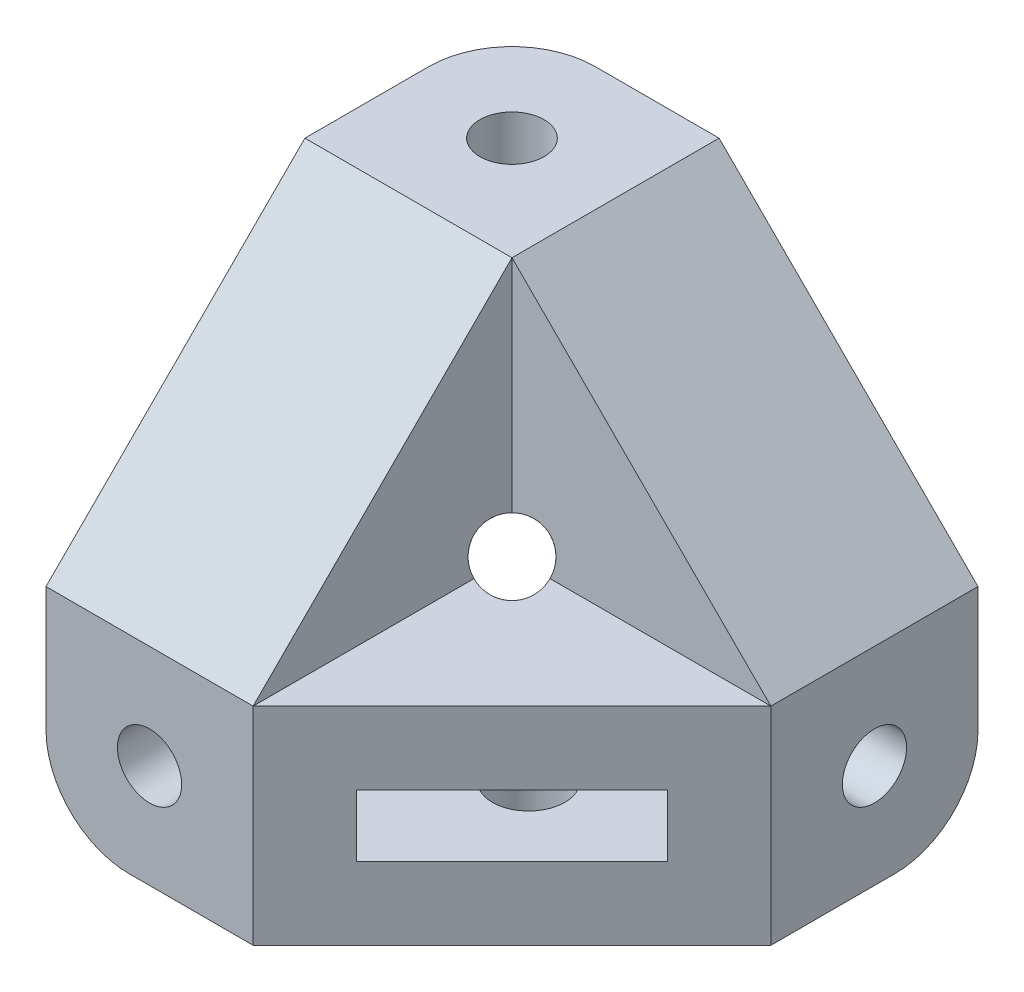
from build123d import *

# Parameters (mm, degrees)
ESBO_O1_W                        = 45
ESBO_O1_H                        = 45
RESSALTO_EXTRUS_O1_DEPTH         = 20
ESBO_O2_W                        = 25
ESBO_O2_H                        = 25
CORTE_EXTRUS_O1_DEPTH            = 70.705238631
ESBO_O3_W                        = 20
ESBO_O3_H                        = 20
RESSALTO_EXTRUS_O2_DEPTH         = 25
FURO_DE_DI_METRO_6_2_6_2_1_D     = 6.2
FURO_DE_DI_METRO_6_2_6_2_1_DEPTH = 35
FURO_DE_DI_METRO_6_2_6_2_2_D     = 6.2
FURO_DE_DI_METRO_6_2_6_2_2_DEPTH = 35
FURO_DE_DI_METRO_6_2_6_2_3_D     = 6.2
FURO_DE_DI_METRO_6_2_6_2_3_DEPTH = 35
FILETE2_R                        = 8
CHANFRO1_SIZE                    = 25
CHANFRO2_SIZE                    = 25
RESSALTO_EXTRUS_O3_DEPTH         = 20
ESBO_O12_R                       = 3
CORTE_EXTRUS_O2_DEPTH            = 71.906960985
CORTE_EXTRUS_O5_DEPTH            = 3
CORTE_EXTRUS_O5_DEPTH_BACK       = 3
ESBO_O18_R                       = 3.5
CORTE_EXTRUS_O6_DEPTH            = 69.698424668


# Some blends are built 0.0001 mm under size
with BuildPart() as part:
    # Esboço1 → Ressalto-extrusão1 (new body)
    with BuildSketch(Plane.XY.offset(20)):
        with Locations((-12.862035225, 34.142270059)):
            Rectangle(ESBO_O1_W, ESBO_O1_H)
    extrude(amount=-RESSALTO_EXTRUS_O1_DEPTH)

    # Esboço2 → Corte-extrusão1 (cut, through all)
    with BuildSketch(Plane(origin=(0, 0, 0), x_dir=(-1, 0, 0), z_dir=(0, 0, -1))):
        with Locations((2.862035225, 44.142270059)):
            Rectangle(ESBO_O2_W, ESBO_O2_H)
    extrude(amount=-CORTE_EXTRUS_O1_DEPTH, mode=Mode.SUBTRACT)

    # Esboço3 → Ressalto-extrusão2 (add)
    with BuildSketch(Plane.XY.offset(20)):
        with Locations((-25.362035225, 21.642270059)):
            Rectangle(ESBO_O3_W, ESBO_O3_H)
    extrude(amount=RESSALTO_EXTRUS_O2_DEPTH)

    # Furo de diâmetro Ø6.2 (6.2)1
    with Locations(Plane(origin=(9.637964775, 0, 0), x_dir=(0, 0, -1), z_dir=(1, 0, 0))):
        with Locations((-10, 21.642270059)):
            Hole(FURO_DE_DI_METRO_6_2_6_2_1_D / 2, depth=FURO_DE_DI_METRO_6_2_6_2_1_DEPTH)

    # Furo de diâmetro Ø6.2 (6.2)2
    with Locations(Plane(origin=(0, 56.642270059, 0), x_dir=(1, 0, 0), z_dir=(0, 1, 0))):
        with Locations((-25.362035225, -10)):
            Hole(FURO_DE_DI_METRO_6_2_6_2_2_D / 2, depth=FURO_DE_DI_METRO_6_2_6_2_2_DEPTH)

    # Furo de diâmetro Ø6.2 (6.2)3
    with Locations(Plane.XY.offset(45)):
        with Locations((-25.362035225, 21.642270059)):
            Hole(FURO_DE_DI_METRO_6_2_6_2_3_D / 2, depth=FURO_DE_DI_METRO_6_2_6_2_3_DEPTH)

    # Filete2
    filete2_edges = [part.edges().sort_by_distance(p)[0] for p in [
        (-35.362035225, 34.142270059, 0),
        (-12.862035225, 11.642270059, 0),
        (-35.362035225, 11.642270059, 22.5),
    ]]
    fillet(filete2_edges, radius=FILETE2_R)

    # Chanfro1
    # the kernel refuses this chamfer: 25 mm, written as the material it adds along each edge
    with BuildSketch(Plane(origin=(-35.362035225, 31.642270059, 20), x_dir=(0, -0.027495876610586317, 0.9996219169112966), z_dir=(1, 0, 0))) as chanfro1_piece_1_section:
        Polygon((CHANFRO1_SIZE * 0.999621916911, -CHANFRO1_SIZE * 0.0274958766106), (-CHANFRO1_SIZE * 0.0274958766106, -CHANFRO1_SIZE * 0.999621916911), (0, 0), align=None)
    chanfro1_piece_1 = extrude(amount=20, mode=Mode.PRIVATE)
    chanfro1_piece_1 = split(chanfro1_piece_1, bisect_by=Plane(origin=(-25.362035225, 39.873368248, 45), z_dir=(0, 0, -1)), keep=Keep.TOP, mode=Mode.PRIVATE)
    chanfro1_piece_1 = split(chanfro1_piece_1, bisect_by=Plane(origin=(-25.362035225, 56.642270059, 28.231098189), z_dir=(0, -1, 0)), keep=Keep.TOP, mode=Mode.PRIVATE)
    add(chanfro1_piece_1)

    # Chanfro2
    chanfro2_edges = [part.edges().sort_by_distance(p)[0] for p in [
        (-15.362035225, 31.642270059, 10),
    ]]
    chamfer(chanfro2_edges, length=CHANFRO2_SIZE - 0.0001)  # a hair under: the kernel refuses the full size

    # Esboço10 → Ressalto-extrusão3 (add)
    with BuildSketch(Plane.XZ.offset(-11.642270059)):
        Polygon((-15.362035225, 45), (9.637964775, 20), (-15.362035225, 20), align=None)
    extrude(amount=-RESSALTO_EXTRUS_O3_DEPTH)

    # Esboço12 → Corte-extrusão2 (cut, through all)
    with BuildSketch(Plane(origin=(20.426744945, 20.426744945, 20.426744945), x_dir=(-0.8164965809277259, 0.408248290463863, 0.4082482904638632), z_dir=(-0.577350269189626, -0.5773502691896256, -0.5773502691896258))):
        with Locations(Location((33.625917704, 8.232328107, 0), (0, 0, 120.000005232))):
            Circle(ESBO_O12_R)
    extrude(amount=CORTE_EXTRUS_O2_DEPTH, mode=Mode.SUBTRACT)

    # Esboço16 → Corte-extrusão5 (cut, two sides: drawn at the far end of the back side and taken through both)
    with BuildSketch(Plane(origin=(0, 21.642270059, 0), x_dir=(-1, 0, 0), z_dir=(0, -1, 0)).offset(-CORTE_EXTRUS_O5_DEPTH_BACK)):
        Polygon((10.362035225, -40), (17.262035225, -33.1), (17.262035225, -18.1), (-4.637964775, -18.1), (-4.637964775, -25), align=None)
    extrude(amount=CORTE_EXTRUS_O5_DEPTH + CORTE_EXTRUS_O5_DEPTH_BACK, mode=Mode.SUBTRACT)

    # Esboço18 → Corte-extrusão6 (cut, through all)
    with BuildSketch(Plane(origin=(0, 18.642270059, 0), x_dir=(1, 0, 0), z_dir=(0, 1, 0))):
        with Locations(Location((-8.762035225, -25, 0), (0, 0, 270))):
            Circle(ESBO_O18_R)
    extrude(amount=-CORTE_EXTRUS_O6_DEPTH, mode=Mode.SUBTRACT)


solid = part.part
